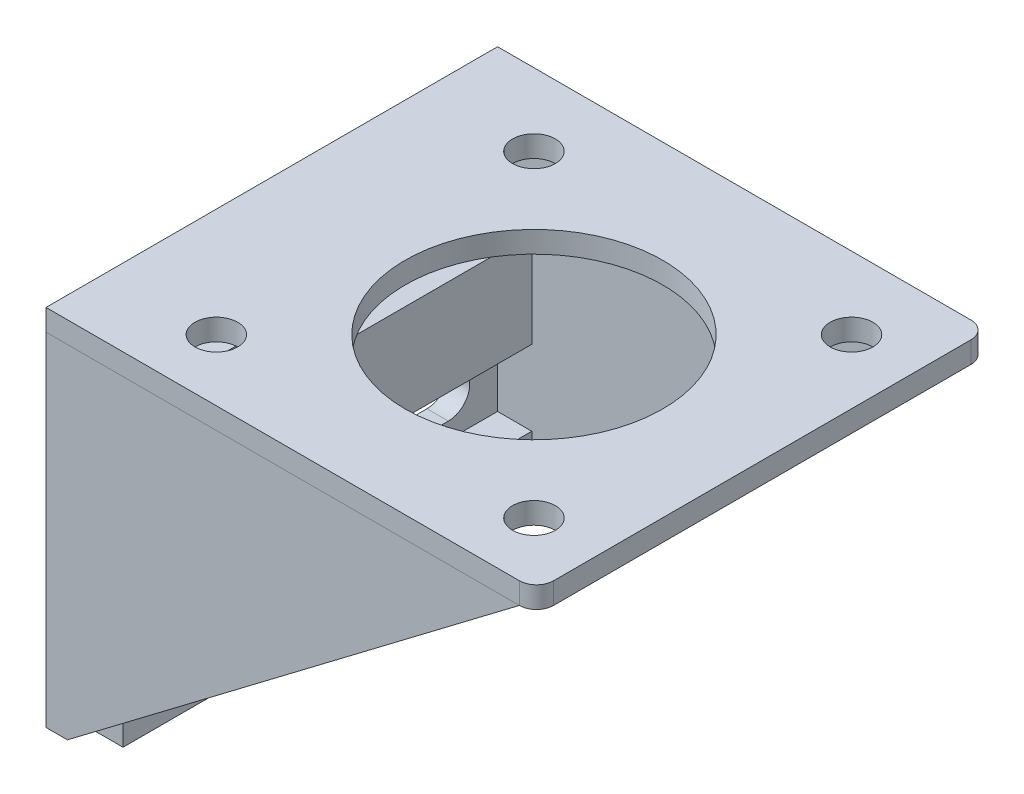
from build123d import *

# Parameters (mm, degrees)
SKETCH1_W           = 72.771
SKETCH1_H           = 66.9925
SKETCH1_R           = 19.1135
SKETCH1_R_2         = 3.175
BOSS_EXTRUDE1_DEPTH = 3.175
FILLET1_R           = 2.54
SKETCH2_W           = 66.9925
SKETCH2_H           = 50.8
BOSS_EXTRUDE2_DEPTH = 3.175
BOSS_EXTRUDE5_DEPTH = 3.175
BOSS_EXTRUDE6_DEPTH = 3.175
CUT_EXTRUDE1_DEPTH  = 3.175
SKETCH10_W          = 60.6425
SKETCH10_H          = 3.937
SKETCH10_H_2        = 14.224
SKETCH10_H_3        = 10.287
BOSS_EXTRUDE7_DEPTH = 5.08


with BuildPart() as part:
    # Sketch1 → Boss-Extrude1 (new body)
    with BuildSketch(Plane(origin=(0, 0, 0), x_dir=(1, 0, 0), z_dir=(0, 1, 0))):
        with Locations((-3.302, 0.79375)):
            Rectangle(SKETCH1_W, SKETCH1_H)
        Circle(SKETCH1_R, mode=Mode.SUBTRACT)
        with Locations((-23.5585, 23.5585)):
            Circle(SKETCH1_R_2, mode=Mode.SUBTRACT)
        with Locations((23.5585, 23.5585)):
            Circle(SKETCH1_R_2, mode=Mode.SUBTRACT)
        with Locations((23.5585, -23.5585)):
            Circle(SKETCH1_R_2, mode=Mode.SUBTRACT)
        with Locations((-23.5585, -23.5585)):
            Circle(SKETCH1_R_2, mode=Mode.SUBTRACT)
    extrude(amount=BOSS_EXTRUDE1_DEPTH)

    # Fillet1
    fillet1_edges = [part.edges().sort_by_distance(p)[0] for p in [
        (33.0835, 1.5875, 32.7025),
        (33.0835, 1.5875, -34.29),
    ]]
    fillet(fillet1_edges, radius=FILLET1_R)

    # Sketch2 → Boss-Extrude2 (add)
    with BuildSketch(Plane.ZY.offset(39.6875)):
        with Locations((-0.79375, -25.4)):
            Rectangle(SKETCH2_W, SKETCH2_H)
    extrude(amount=-BOSS_EXTRUDE2_DEPTH)

    # Sketch7 → Boss-Extrude5 (add)
    with BuildSketch(Plane.XY.offset(32.7025)):
        Polygon((-36.5125, -50.8), (30.5435, 0), (-36.5125, 0), align=None)
    extrude(amount=-BOSS_EXTRUDE5_DEPTH)

    # Sketch8 → Boss-Extrude6 (add)
    with BuildSketch(Plane(origin=(0, 0, -34.29), x_dir=(-1, 0, 0), z_dir=(0, 0, -1))):
        Polygon((-30.5435, 0), (36.5125, 0), (36.5125, -50.8), align=None)
    extrude(amount=-BOSS_EXTRUDE6_DEPTH)

    # Sketch9 → Cut-Extrude1 (cut)
    with BuildSketch(Plane(origin=(-36.5125, 0, 0), x_dir=(0, 0, -1), z_dir=(1, 0, 0))):
        with BuildLine():
            Line((-12.3825, -12.7), (-2.2225, -12.7))
            ThreePointArc((-2.2225, -12.7), (0.9525, -9.525), (-2.2225, -6.35))
            Line((-2.2225, -6.35), (-12.3825, -6.35))
            ThreePointArc((-12.3825, -6.35), (-15.5575, -9.525), (-12.3825, -12.7))
        make_face()
        with BuildLine():
            Line((-12.3825, -38.1), (-2.2225, -38.1))
            ThreePointArc((-2.2225, -38.1), (0.9525, -34.925), (-2.2225, -31.75))
            Line((-2.2225, -31.75), (-12.3825, -31.75))
            ThreePointArc((-12.3825, -31.75), (-15.5575, -34.925), (-12.3825, -38.1))
        make_face()
        with BuildLine():
            Line((13.6525, -38.1), (23.8125, -38.1))
            ThreePointArc((23.8125, -38.1), (26.9875, -34.925), (23.8125, -31.75))
            Line((23.8125, -31.75), (13.6525, -31.75))
            ThreePointArc((13.6525, -31.75), (10.4775, -34.925), (13.6525, -38.1))
        make_face()
        with BuildLine():
            Line((13.6525, -12.7), (23.8125, -12.7))
            ThreePointArc((23.8125, -12.7), (26.9875, -9.525), (23.8125, -6.35))
            Line((23.8125, -6.35), (13.6525, -6.35))
            ThreePointArc((13.6525, -6.35), (10.4775, -9.525), (13.6525, -12.7))
        make_face()
    extrude(amount=-CUT_EXTRUDE1_DEPTH, mode=Mode.SUBTRACT)

    # Sketch10 → Boss-Extrude7 (add)
    with BuildSketch(Plane(origin=(-36.5125, 0, 0), x_dir=(0, 0, -1), z_dir=(1, 0, 0))):
        with Locations((0.79375, -1.9685)):
            Rectangle(SKETCH10_W, SKETCH10_H)
        with Locations((0.79375, -22.225)):
            Rectangle(SKETCH10_W, SKETCH10_H_2)
        with Locations((0.79375, -45.6565)):
            Rectangle(SKETCH10_W, SKETCH10_H_3)
    extrude(amount=BOSS_EXTRUDE7_DEPTH)


with BuildPart() as body_2:
    # Split1: the piece on the far side of the plane
    add(part.part)
    split(bisect_by=Plane(origin=(0, 0, 0), x_dir=(0, 0, -1), z_dir=(0, -1, 0)), keep=Keep.BOTTOM)


with BuildPart() as part_1:
    add(part.part)

    # Split1
    split(bisect_by=Plane(origin=(0, 0, 0), x_dir=(0, 0, -1), z_dir=(0, -1, 0)), keep=Keep.TOP)


solid = Compound([body_2.part, part_1.part])
